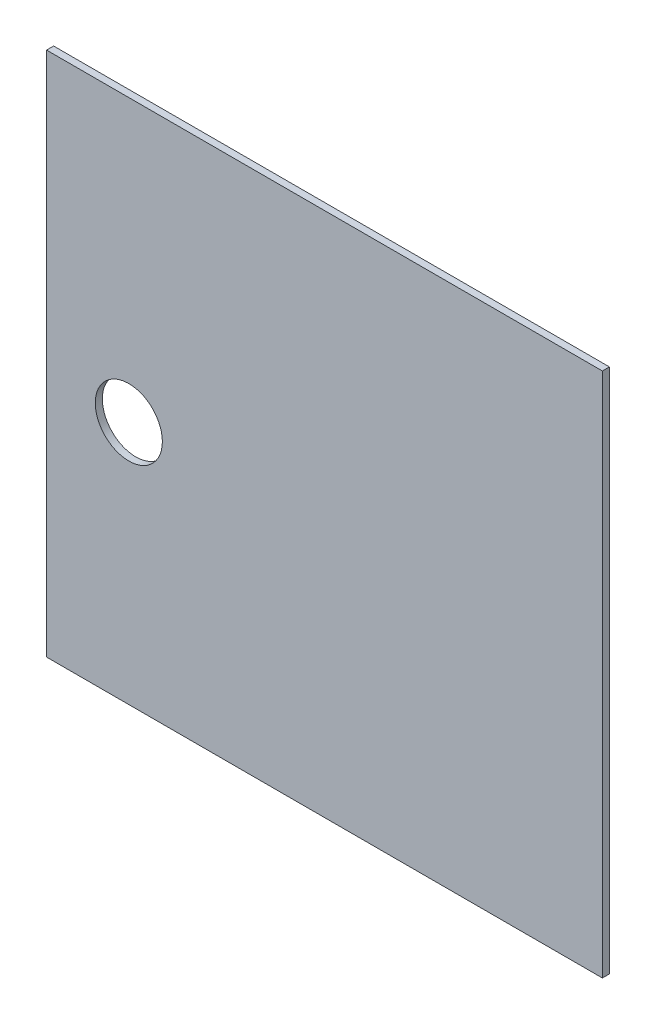
from build123d import *

# Parameters (mm, degrees)
SKETCH1_W           = 236.55
SKETCH1_H           = 223.74
BOSS_EXTRUDE1_DEPTH = 3
SKETCH2_R           = 14.275
CUT_EXTRUDE1_DEPTH  = 3


with BuildPart() as part:
    # Sketch1 → Boss-Extrude1 (new body)
    with BuildSketch(Plane.XY):
        with Locations((118.275, 111.87)):
            Rectangle(SKETCH1_W, SKETCH1_H)
    extrude(amount=BOSS_EXTRUDE1_DEPTH)

    # Sketch2 → Cut-Extrude1 (cut)
    with BuildSketch(Plane.XY.offset(3)):
        with Locations((35, 104.05)):
            Circle(SKETCH2_R)
    extrude(amount=-CUT_EXTRUDE1_DEPTH, mode=Mode.SUBTRACT)


solid = part.part
